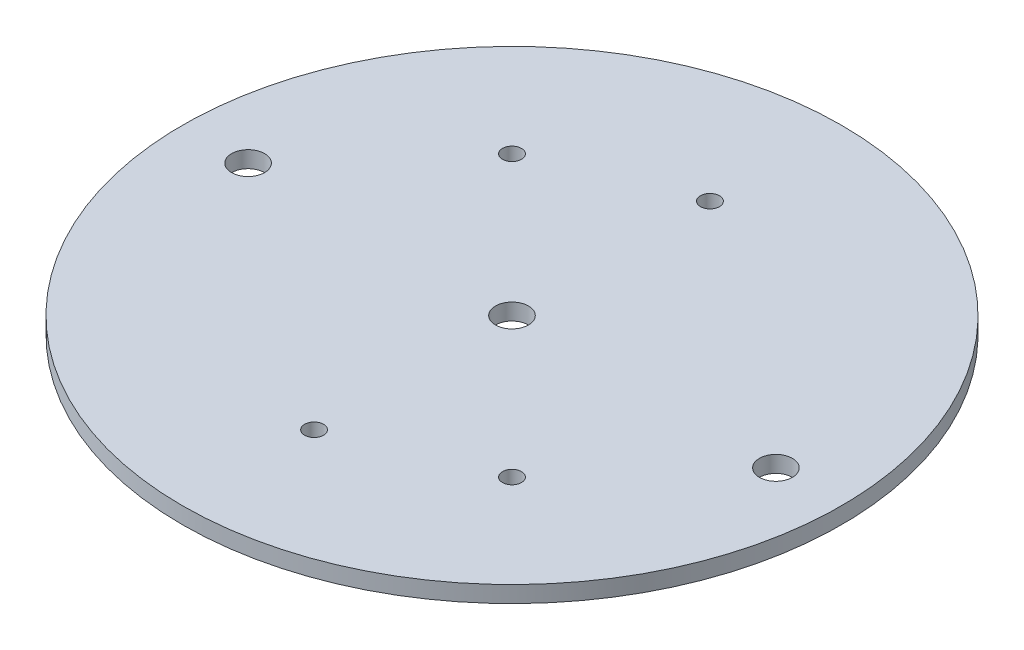
from build123d import *

# Parameters (mm, degrees)
SKETCH2_R           = 63.4365
SKETCH2_R_2         = 3.175
SKETCH2_R_3         = 1.8288
BOSS_EXTRUDE1_DEPTH = 3.175


with BuildPart() as part:
    # Sketch2 → Boss-Extrude1 (new body)
    with BuildSketch(Plane(origin=(0, 0, 0), x_dir=(1, 0, 0), z_dir=(0, 1, 0))):
        Circle(SKETCH2_R)
        with Locations((-50.8, 0)):
            Circle(SKETCH2_R_2, mode=Mode.SUBTRACT)
        with Locations((50.8, 0)):
            Circle(SKETCH2_R_2, mode=Mode.SUBTRACT)
        Circle(SKETCH2_R_2, mode=Mode.SUBTRACT)
        with Locations((0, 38.1)):
            Circle(SKETCH2_R_3, mode=Mode.SUBTRACT)
        with Locations((0, -38.1)):
            Circle(SKETCH2_R_3, mode=Mode.SUBTRACT)
        with Locations((-26.940768363, 26.940768363)):
            Circle(SKETCH2_R_3, mode=Mode.SUBTRACT)
        with Locations((26.940768363, -26.940768363)):
            Circle(SKETCH2_R_3, mode=Mode.SUBTRACT)
    extrude(amount=BOSS_EXTRUDE1_DEPTH)


solid = part.part
